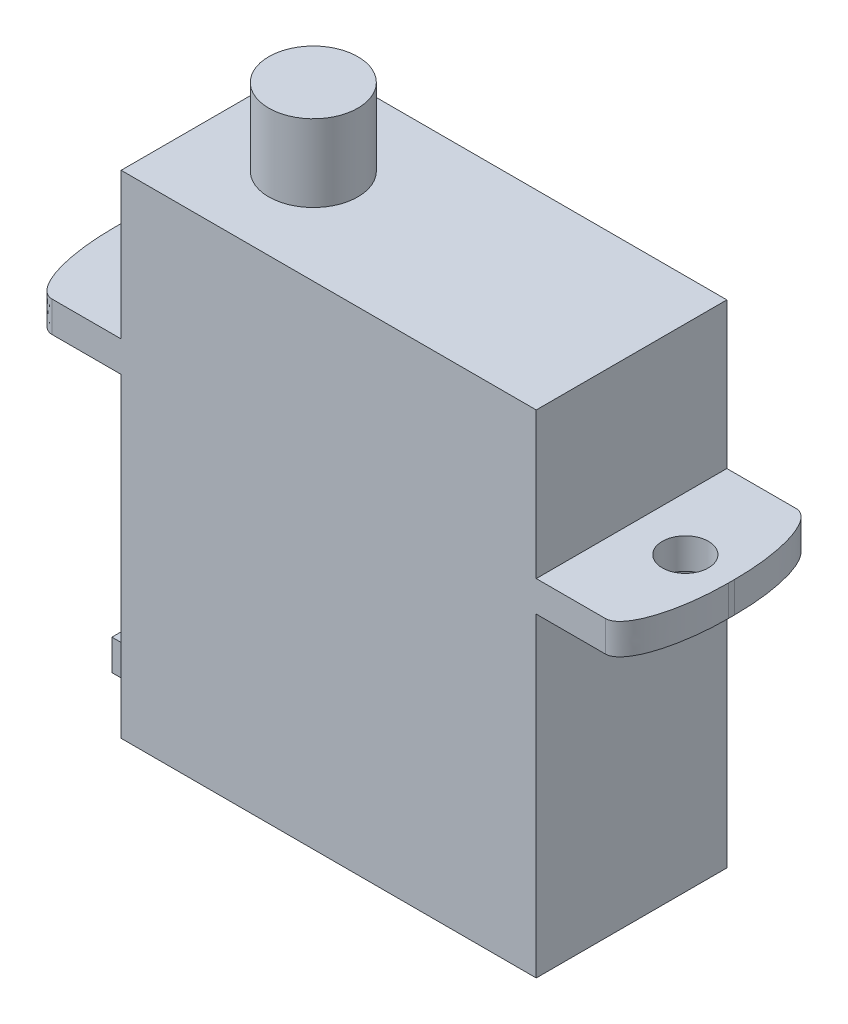
from build123d import *

# Parameters (mm, degrees)
SKETCH_1_W          = 13.5
SKETCH_1_H          = 6.2
EXTRUDE_1_DEPTH     = 16
SKETCH_2_W          = 3.25
SKETCH_2_H          = 1
EXTRUDE_2_DEPTH     = 6.2
SKETCH_3_R          = 0.75
CUT_EXTRUDE_1_DEPTH = 22.108410646
SKETCH_4_R          = 1.45
EXTRUDE_3_DEPTH     = 2.5
FILLET_1_SIZE       = 1
FILLET_1_SIZE_2     = 3
FILLET_2_SIZE       = 1
FILLET_2_SIZE_2     = 3
SKETCH_5_W          = 3
SKETCH_5_H          = 1
EXTRUDE_4_DEPTH     = 2


with BuildPart() as part:
    # 草图1 → 凸台-拉伸1 (new body)
    with BuildSketch(Plane(origin=(0, 0, 0), x_dir=(1, 0, 0), z_dir=(0, 1, 0))):
        with Locations((-6.75, 3.1)):
            Rectangle(SKETCH_1_W, SKETCH_1_H)
    extrude(amount=EXTRUDE_1_DEPTH)

    # 草图2 → 凸台-拉伸2 (add)
    with BuildSketch(Plane.XY):
        with Locations((1.625, 10.75)):
            Rectangle(SKETCH_2_W, SKETCH_2_H)
        with Locations((-15.125, 10.75)):
            Rectangle(SKETCH_2_W, SKETCH_2_H)
    extrude(amount=-EXTRUDE_2_DEPTH)

    # 草图3 → 切除-拉伸1 (cut, through all)
    with BuildSketch(Plane(origin=(0, 11.25, 0), x_dir=(1, 0, 0), z_dir=(0, 1, 0))):
        with Locations(Location((-15.25, 3.1, 0), (0, 0, 270))):
            Circle(SKETCH_3_R)
        with Locations(Location((1.75, 3.1, 0), (0, 0, 270))):
            Circle(SKETCH_3_R)
    extrude(amount=-CUT_EXTRUDE_1_DEPTH, mode=Mode.SUBTRACT)

    # 草图4 → 凸台-拉伸3 (add)
    with BuildSketch(Plane(origin=(0, 16, 0), x_dir=(1, 0, 0), z_dir=(0, 1, 0))):
        with Locations(Location((-10.35, 3.1, 0), (0, 0, 270))):
            Circle(SKETCH_4_R)
    extrude(amount=EXTRUDE_3_DEPTH)

    # 圆角1
    # an asymmetric fillet: 3, 1 mm, written as the material it takes off along each edge
    with BuildSketch(Plane(origin=(3.25, 2.75, 0), x_dir=(-1, 0, 0), z_dir=(0, 1, 0))) as fillet_1_piece_1:
        with BuildLine():
            Bezier((FILLET_1_SIZE, 0), (0, 0), (0, -FILLET_1_SIZE_2), weights=[1, 0.707106781, 1])
            Line((0, -FILLET_1_SIZE_2), (0, 0))
            Line((0, 0), (FILLET_1_SIZE, 0))
        make_face()
    extrude(amount=16, mode=Mode.SUBTRACT)
    with BuildSketch(Plane(origin=(-16.75, 2.75, -6.2), x_dir=(0, 0, 1), z_dir=(0, 1, 0))) as fillet_1_piece_2:
        with BuildLine():
            Bezier((FILLET_1_SIZE_2, 0), (0, 0), (0, FILLET_1_SIZE), weights=[1, 0.707106781, 1])
            Line((0, FILLET_1_SIZE), (0, 0))
            Line((0, 0), (FILLET_1_SIZE_2, 0))
        make_face()
    extrude(amount=16, mode=Mode.SUBTRACT)

    # 圆角2
    # an asymmetric fillet: 3, 1 mm, written as the material it takes off along each edge
    with BuildSketch(Plane(origin=(-16.75, 2.75, 0), x_dir=(1, 0, 0), z_dir=(0, 1, 0)), Plane(origin=(3.25, 2.75, -6.2), x_dir=(-1, 0, 0), z_dir=(0, 1, 0))) as fillet_2_piece_1:
        with BuildLine():
            Bezier((FILLET_2_SIZE, 0), (0, 0), (0, FILLET_2_SIZE_2), weights=[1, 0.707106781, 1])
            Line((0, FILLET_2_SIZE_2), (0, 0))
            Line((0, 0), (FILLET_2_SIZE, 0))
        make_face()
    extrude(amount=16, mode=Mode.SUBTRACT)

    # 草图5 → 凸台-拉伸4 (add)
    with BuildSketch(Plane.ZY.offset(13.5)):
        with Locations((-3.2, 0.5)):
            Rectangle(SKETCH_5_W, SKETCH_5_H)
    extrude(amount=EXTRUDE_4_DEPTH)


solid = part.part
